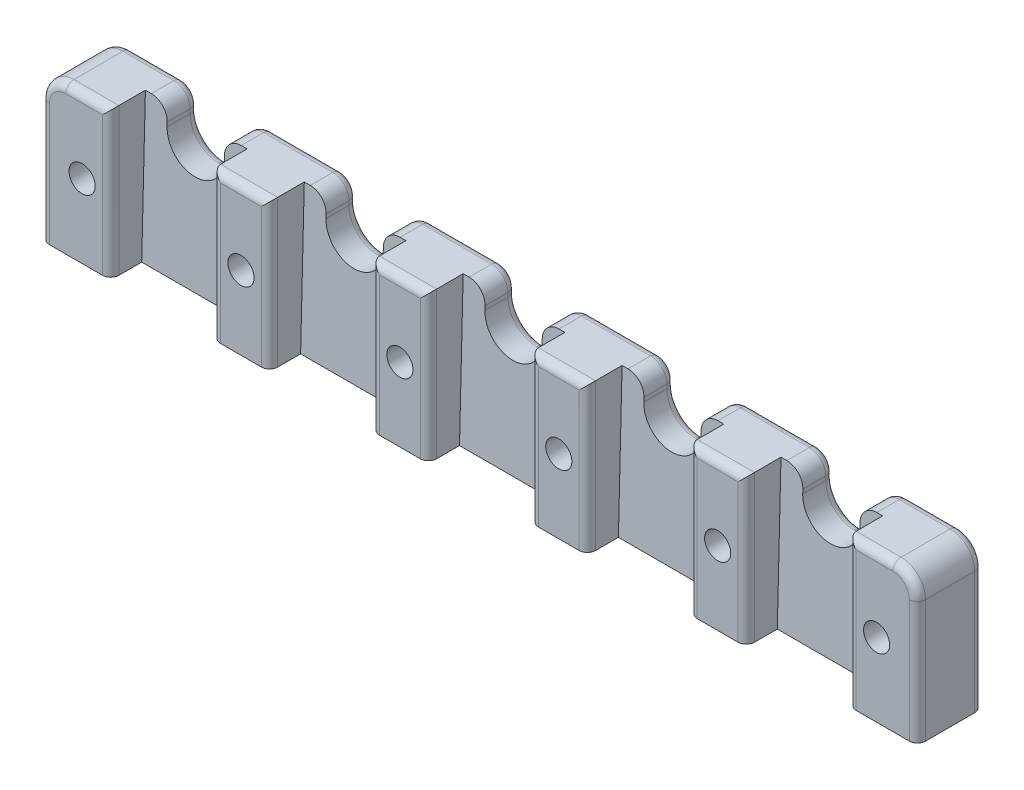
from build123d import *

# Parameters (mm, degrees)
SKETCH1_W                       = 12.45
SKETCH1_H                       = 21.45
BOSS_EXTRUDE1_DEPTH             = 18
SKETCH2_W                       = 10
SKETCH2_H                       = 3
BOSS_EXTRUDE2_DEPTH             = 18
SKETCH4_W                       = 7
SKETCH4_H                       = 8.185466
SKETCH4_H_2                     = 9.121134
SKETCH4_H_3                     = 13.415592
SKETCH4_H_4                     = 10.115072
SKETCH4_H_5                     = 8.5758
CUT_EXTRUDE2_DEPTH              = 6
FILLET3_R                       = 3.5
FILLET4_R                       = 2
SKETCH5_R                       = 1.6
CUT_EXTRUDE3_DEPTH              = 105.163684
CUT_EXTRUDE4_DEPTH              = 105.163684
SKETCH10_W                      = 7.3675
SKETCH10_H                      = 18
SKETCH10_R                      = 1.6
BOSS_EXTRUDE4_DEPTH             = 21.45
FILLET6_R                       = 3
SKETCH11_W                      = 114.139508
SKETCH11_H                      = 1
CUT_EXTRUDE5_DEPTH              = 97.285729
CHAMFER2_SIZE                   = 1
FILLET7_R                       = 1
FILLET8_R                       = 1
FILLET9_R                       = 1
SKETCH13_R                      = 2.05
CUT_EXTRUDE6_DEPTH              = 8
SKETCH14_R                      = 2.05
CUT_EXTRUDE7_DEPTH              = 10
SKETCH15_W                      = 114.000332
SKETCH15_H                      = 33.143594
CUT_EXTRUDE8_DEPTH              = 97.285729
SKETCH16_R                      = 3
CUT_EXTRUDE9_DEPTH              = 2
CHAMFER3_SIZE                   = 0.5
BOSS_EXTRUDE5_REACH             = 91.224
BOSS_EXTRUDE5_DIRECTION_2_DEPTH = 13
SKETCH18_R                      = 1.6
CUT_EXTRUDE10_DEPTH             = 10


with BuildPart() as part:
    # Sketch1 → Boss-Extrude1 (new body)
    with BuildSketch(Plane(origin=(0, 0, 0), x_dir=(1, 0, 0), z_dir=(0, 1, 0))):
        Polygon((-19.225, -19.625), (-5.1, -19.625), (-5.1, -13.725), (5.1, -13.725), (5.1, -19.625), (14.35, -19.625), (14.35, -13.725), (24.55, -13.725), (24.55, -19.625), (33.8, -19.625), (33.8, -13.725), (44, -13.725), (44, -19.625), (53.25, -19.625), (53.25, -13.725), (63.45, -13.725), (63.45, -19.625), (72.7, -19.625), (72.7, -13.725), (82.9, -13.725), (82.9, -19.625), (97.025, -19.625), (97.025, -10.725), (87.025, -10.725), (87.025, 13.725), (-9.225, 13.725), (-9.225, -10.725), (-19.225, -10.725), align=None)
        Rectangle(SKETCH1_W, SKETCH1_H, mode=Mode.SUBTRACT)
        with Locations((19.45, 0)):
            Rectangle(SKETCH1_W, SKETCH1_H, mode=Mode.SUBTRACT)
        with Locations((38.9, 0)):
            Rectangle(SKETCH1_W, SKETCH1_H, mode=Mode.SUBTRACT)
        with Locations((58.35, 0)):
            Rectangle(SKETCH1_W, SKETCH1_H, mode=Mode.SUBTRACT)
        with Locations((77.8, 0)):
            Rectangle(SKETCH1_W, SKETCH1_H, mode=Mode.SUBTRACT)
    extrude(amount=BOSS_EXTRUDE1_DEPTH)

    # Sketch2 → Boss-Extrude2 (add)
    with BuildSketch(Plane(origin=(0, 18, 0), x_dir=(1, 0, 0), z_dir=(0, 1, 0))):
        with Locations((-14.225, -9.225)):
            Rectangle(SKETCH2_W, SKETCH2_H)
        with Locations((92.025, -9.225)):
            Rectangle(SKETCH2_W, SKETCH2_H)
    extrude(amount=-BOSS_EXTRUDE2_DEPTH)

    # Sketch4 → Cut-Extrude2 (cut)
    with BuildSketch(Plane(origin=(0, 18, 0), x_dir=(1, 0, 0), z_dir=(0, 1, 0))):
        with Locations((0, 10.725)):
            Rectangle(SKETCH4_W, SKETCH4_H)
        with Locations((19.45, 10.725)):
            Rectangle(SKETCH4_W, SKETCH4_H_2)
        with Locations((38.9, 10.725)):
            Rectangle(SKETCH4_W, SKETCH4_H_3)
        with Locations((58.35, 10.725)):
            Rectangle(SKETCH4_W, SKETCH4_H_4)
        with Locations((77.8, 10.725)):
            Rectangle(SKETCH4_W, SKETCH4_H_5)
    extrude(amount=-CUT_EXTRUDE2_DEPTH, mode=Mode.SUBTRACT)

    # Fillet3
    fillet3_edges = [part.edges().sort_by_distance(p)[0] for p in [
        (81.3, 12, -12.225),
        (74.3, 12, -12.225),
        (54.85, 12, -12.225),
        (61.85, 12, -12.225),
        (42.4, 12, -12.225),
        (35.4, 12, -12.225),
        (15.95, 12, -12.225),
        (22.95, 12, -12.225),
        (3.5, 12, -12.225),
        (-3.5, 12, -12.225),
    ]]
    fillet(fillet3_edges, radius=FILLET3_R - 0.0001)  # a hair under: the kernel refuses the full size

    # Fillet4
    fillet4_edges = [part.edges().sort_by_distance(p)[0] for p in [
        (74.3, 18, -12.225),
        (81.3, 18, -12.225),
        (54.85, 18, -12.225),
        (61.85, 18, -12.225),
        (35.4, 18, -12.225),
        (42.4, 18, -12.225),
        (15.95, 18, -12.225),
        (22.95, 18, -12.225),
        (-3.5, 18, -12.225),
        (3.5, 18, -12.225),
    ]]
    fillet(fillet4_edges, radius=FILLET4_R)

    # Sketch5 → Cut-Extrude3 (cut, through all)
    with BuildSketch(Plane.XY.offset(19.625)):
        with Locations((9.725, 9)):
            Circle(SKETCH5_R)
        with Locations((29.175, 9)):
            Circle(SKETCH5_R)
        with Locations((48.625, 9)):
            Circle(SKETCH5_R)
        with Locations((68.075, 9)):
            Circle(SKETCH5_R)
        with Locations((87.53, 9)):
            Circle(SKETCH5_R)
        with Locations((-9.73, 9)):
            Circle(SKETCH5_R)
    extrude(amount=-CUT_EXTRUDE3_DEPTH, mode=Mode.SUBTRACT)

    # Sketch7 → Cut-Extrude4 (cut, through all)
    with BuildSketch(Plane(origin=(0, 0, -13.725), x_dir=(-1, 0, 0), z_dir=(0, 0, -1))):
        Polygon((-92.53, 9), (-92.53, -2.934604), (-102.870987, -2.934604), (-102.870987, 21.319522), (-92.53, 21.319522), align=None)
        Polygon((14.73, 9), (14.73, -3.337318), (26.940385, -3.337318), (26.940385, 20.180652), (14.73, 20.180652), align=None)
    extrude(amount=-CUT_EXTRUDE4_DEPTH, mode=Mode.SUBTRACT)

    # Sketch10 → Boss-Extrude4 (add)
    # profile 1 of 2: a face of its own
    with BuildSketch(Plane(origin=(0, 0, 7.725), x_dir=(-1, 0, 0), z_dir=(0, 0, -1))):
        with Locations((-88.84625, 9)):
            Rectangle(SKETCH10_W, SKETCH10_H)
        with Locations(Location((-87.53, 9, 0), (0, 0, 180))):
            Circle(SKETCH10_R, mode=Mode.SUBTRACT)
    # profile 2 of 2: a face of its own
    with BuildSketch(Plane(origin=(0, 0, 7.725), x_dir=(-1, 0, 0), z_dir=(0, 0, -1))):
        with Locations((11.04625, 9)):
            Rectangle(SKETCH10_W, SKETCH10_H)
        with Locations(Location((9.73, 9, 0), (0, 0, 180))):
            Circle(SKETCH10_R, mode=Mode.SUBTRACT)
    extrude(amount=BOSS_EXTRUDE4_DEPTH)

    # Fillet6
    fillet6_edges = [part.edges().sort_by_distance(p)[0] for p in [
        (92.53, 18, 2.95),
        (-14.73, 18, 2.95),
    ]]
    fillet(fillet6_edges, radius=FILLET6_R)

    # Sketch11 → Cut-Extrude5 (cut, through all)
    with BuildSketch(Plane(origin=(0, 18, 0), x_dir=(1, 0, 0), z_dir=(0, 1, 0))):
        with Locations((38.937615, 5.225)):
            Rectangle(SKETCH11_W, SKETCH11_H)
    extrude(amount=-CUT_EXTRUDE5_DEPTH, mode=Mode.SUBTRACT)


with BuildPart() as cut_extrude5_piece_1:
    # of the separate pieces the step leaves, piece 1, a body of its own (cut_extrude5_pieces)
    add(part.part.solids().sort_by_distance((-11.73, 18, -4.725))[0])

    # Chamfer2
    chamfer2_edges = [cut_extrude5_piece_1.edges().sort_by_distance(p)[0] for p in [
        (-9.915, 0, 19.625),
        (-14.73, 0, 7.45),
        (68.075, 0, 19.625),
        (63.45, 0, 16.675),
        (58.35, 0, 13.725),
        (53.25, 0, 16.675),
        (48.625, 0, 19.625),
        (44, 0, 16.675),
        (38.9, 0, 13.725),
        (33.8, 0, 16.675),
        (29.175, 0, 19.625),
        (24.55, 0, 16.675),
        (19.45, 0, 13.725),
        (14.35, 0, 16.675),
        (9.725, 0, 19.625),
        (5.1, 0, 16.675),
        (0, 0, 13.725),
        (-5.1, 0, 16.675),
        (92.53, 0, 7.45),
        (-6.225, 0, 3),
        (6.225, 0, 3),
        (25.675, 0, 3),
        (87.715, 0, 19.625),
        (13.225, 0, 3),
        (45.125, 0, 3),
        (32.675, 0, 3),
        (64.575, 0, 3),
        (52.125, 0, 3),
        (84.025, 0, 3),
        (71.575, 0, 3),
        (82.9, 0, 16.675),
        (77.8, 0, 13.725),
        (72.7, 0, 16.675),
        (77.8, 0, 10.725),
        (9.725, 0, -4.725),
        (88.2775, 0, -4.725),
        (68.075, 0, -4.725),
        (48.625, 0, -4.725),
        (29.175, 0, -4.725),
        (-10.4775, 0, -4.725),
        (58.35, 0, 10.725),
        (38.9, 0, 10.725),
        (19.45, 0, 10.725),
        (0, 0, 10.725),
    ]]
    chamfer(chamfer2_edges, length=CHAMFER2_SIZE)

    # Fillet7
    fillet7_edges = [cut_extrude5_piece_1.edges().sort_by_distance(p)[0] for p in [
        (91.65132, 17.12132, -4.725),
        (71.575, 9.5, -4.725),
        (52.125, 9.5, -4.725),
        (32.675, 9.5, -4.725),
        (13.225, 9.5, -4.725),
        (6.225, 9.5, -4.725),
        (84.025, 9.5, -4.725),
        (64.575, 9.5, -4.725),
        (45.125, 9.5, -4.725),
        (25.675, 9.5, -4.725),
        (-6.225, 9.5, -4.725),
        (-14.73, 8, -4.725),
        (-13.85132, 17.12132, -4.725),
        (9.725, 18, -4.725),
        (86.7775, 18, -4.725),
        (68.075, 18, -4.725),
        (48.625, 18, -4.725),
        (29.175, 18, -4.725),
        (-8.9775, 18, -4.725),
        (92.53, 8, -4.725),
    ]]
    fillet(fillet7_edges, radius=FILLET7_R)

    # Sketch13 → Cut-Extrude6 (cut)
    with BuildSketch(Plane.XY.offset(19.625)):
        with Locations((-9.73, 9)):
            Circle(SKETCH13_R)
        with Locations((9.725, 9)):
            Circle(SKETCH13_R)
        with Locations((29.175, 9)):
            Circle(SKETCH13_R)
        with Locations((48.625, 9)):
            Circle(SKETCH13_R)
        with Locations((68.075, 9)):
            Circle(SKETCH13_R)
        with Locations((87.53, 9)):
            Circle(SKETCH13_R)
    extrude(amount=-CUT_EXTRUDE6_DEPTH, mode=Mode.SUBTRACT)

    # Sketch14 → Cut-Extrude7 (cut)
    with BuildSketch(Plane(origin=(0, 0, -4.725), x_dir=(-1, 0, 0), z_dir=(0, 0, -1))):
        with Locations(Location((-87.53, 9, 0), (0, 0, 180))):
            Circle(SKETCH14_R)
        with Locations(Location((-68.075, 9, 0), (0, 0, 180))):
            Circle(SKETCH14_R)
        with Locations(Location((-48.625, 9, 0), (0, 0, 180))):
            Circle(SKETCH14_R)
        with Locations(Location((-29.175, 9, 0), (0, 0, 180))):
            Circle(SKETCH14_R)
        with Locations(Location((-9.725, 9, 0), (0, 0, 180))):
            Circle(SKETCH14_R)
        with Locations(Location((9.73, 9, 0), (0, 0, 180))):
            Circle(SKETCH14_R)
    extrude(amount=-CUT_EXTRUDE7_DEPTH, mode=Mode.SUBTRACT)

    # Sketch15 → Cut-Extrude8 (cut, through all)
    with BuildSketch(Plane.XZ):
        with Locations((37.916031, 11.427603)):
            Rectangle(SKETCH15_W, SKETCH15_H)
    extrude(amount=-CUT_EXTRUDE8_DEPTH, mode=Mode.SUBTRACT)


with BuildPart() as cut_extrude5_piece_2:
    # of the separate pieces the step leaves, piece 2, a body of its own (cut_extrude5_pieces)
    add(part.part.solids().sort_by_distance((-11.73, 18, -13.725))[0])

    # Fillet8
    fillet8_edges = [cut_extrude5_piece_2.edges().sort_by_distance(p)[0] for p in [
        (6.225, 9, -5.725),
        (84.025, 9, -5.725),
        (91.65132, 17.12132, -5.725),
        (86.7775, 18, -5.725),
        (-6.225, 9, -5.725),
        (-8.9775, 18, -5.725),
        (-13.85132, 17.12132, -5.725),
        (13.225, 9, -5.725),
        (9.725, 18, -5.725),
        (32.675, 9, -5.725),
        (29.175, 18, -5.725),
        (52.125, 9, -5.725),
        (48.625, 18, -5.725),
        (71.575, 9, -5.725),
        (68.075, 18, -5.725),
        (64.575, 9, -5.725),
        (45.125, 9, -5.725),
        (25.675, 9, -5.725),
        (92.53, 7.5, -5.725),
        (-14.73, 7.5, -5.725),
    ]]
    fillet(fillet8_edges, radius=FILLET8_R)

    # Fillet9
    fillet9_edges = [cut_extrude5_piece_2.edges().sort_by_distance(p)[0] for p in [
        (-2.474903, 13.025097, -13.725),
        (2.474903, 13.025097, -13.725),
        (4.085786, 17.414214, -13.725),
        (9.725, 18, -13.725),
        (15.364214, 17.414214, -13.725),
        (16.975097, 13.025097, -13.725),
        (21.924903, 13.025097, -13.725),
        (23.535786, 17.414214, -13.725),
        (29.175, 18, -13.725),
        (34.814214, 17.414214, -13.725),
        (36.425097, 13.025097, -13.725),
        (41.374903, 13.025097, -13.725),
        (42.985786, 17.414214, -13.725),
        (48.625, 18, -13.725),
        (54.264214, 17.414214, -13.725),
        (55.875097, 13.025097, -13.725),
        (60.824903, 13.025097, -13.725),
        (62.435786, 17.414214, -13.725),
        (68.075, 18, -13.725),
        (73.714214, 17.414214, -13.725),
        (75.325097, 13.025097, -13.725),
        (80.274903, 13.025097, -13.725),
        (81.885786, 17.414214, -13.725),
        (86.415, 18, -13.725),
        (91.65132, 17.12132, -13.725),
        (92.53, 7.5, -13.725),
        (81.3, 15.74995, -13.725),
        (74.3, 15.74995, -13.725),
        (61.85, 15.74995, -13.725),
        (54.85, 15.74995, -13.725),
        (42.4, 15.74995, -13.725),
        (35.4, 15.74995, -13.725),
        (22.95, 15.74995, -13.725),
        (15.95, 15.74995, -13.725),
        (3.5, 15.74995, -13.725),
        (-3.5, 15.74995, -13.725),
        (-14.73, 7.5, -13.725),
        (-13.85132, 17.12132, -13.725),
        (-8.615, 18, -13.725),
        (-4.085786, 17.414214, -13.725),
    ]]
    fillet(fillet9_edges, radius=FILLET9_R)

    # Sketch16 → Cut-Extrude9 (cut)
    with BuildSketch(Plane(origin=(0, 0, -13.725), x_dir=(-1, 0, 0), z_dir=(0, 0, -1))):
        with Locations((-87.53, 9)):
            Circle(SKETCH16_R)
        with Locations((-68.075, 9)):
            Circle(SKETCH16_R)
        with Locations((-48.625, 9)):
            Circle(SKETCH16_R)
        with Locations((-29.175, 9)):
            Circle(SKETCH16_R)
        with Locations((-9.725, 9)):
            Circle(SKETCH16_R)
        with Locations((9.73, 9)):
            Circle(SKETCH16_R)
    extrude(amount=-CUT_EXTRUDE9_DEPTH, mode=Mode.SUBTRACT)

    # Chamfer3
    chamfer3_edges = [cut_extrude5_piece_2.edges().sort_by_distance(p)[0] for p in [
        (90.53, 9, -13.725),
        (71.075, 9, -13.725),
        (51.625, 9, -13.725),
        (32.175, 9, -13.725),
        (12.725, 9, -13.725),
        (-6.73, 9, -13.725),
    ]]
    chamfer(chamfer3_edges, length=CHAMFER3_SIZE)

    # Boss-Extrude5: up to this face of the body (flat: up to its plane)
    boss_extrude5_end = Plane(cut_extrude5_piece_2.part.faces().sort_by_distance((84.025, 9, -8.725))[0])
    # Sketch17 → Boss-Extrude5 (add, up to the picked face)
    with BuildSketch(Plane.ZY.offset(-6.225), mode=Mode.PRIVATE) as boss_extrude5_sk1:
        Polygon((-10.725, 18), (-10.725, 0), (-9.525, 0), (-9.975, 18), align=None)
    boss_extrude5_tool1 = split(extrude(boss_extrude5_sk1.sketch, amount=-BOSS_EXTRUDE5_REACH, mode=Mode.PRIVATE), bisect_by=boss_extrude5_end, keep=Keep.BOTH, mode=Mode.PRIVATE)
    add(boss_extrude5_tool1.solids().sort_by(Axis((6.225, 8.307692, -10.228846), (1, 0, 0)))[0])

    # Sketch17 → Boss-Extrude5 direction 2 (add)
    with BuildSketch(Plane.ZY.offset(-6.225)):
        Polygon((-10.725, 18), (-10.725, 0), (-9.525, 0), (-9.975, 18), align=None)
    extrude(amount=BOSS_EXTRUDE5_DIRECTION_2_DEPTH)

    # Sketch18 → Cut-Extrude10 (cut)
    with BuildSketch(Plane(origin=(0, 0, -13.725), x_dir=(-1, 0, 0), z_dir=(0, 0, -1))):
        with Locations((-68.075, 9)):
            Circle(SKETCH18_R)
        with Locations((-48.625, 9)):
            Circle(SKETCH18_R)
        with Locations((-29.175, 9)):
            Circle(SKETCH18_R)
        with Locations((-9.725, 9)):
            Circle(SKETCH18_R)
        with BuildLine():
            Line((-72.3, 18), (-83.3, 18))
            ThreePointArc((-83.3, 18), (-81.885786, 17.414214), (-81.3, 16))
            Line((-81.3, 16), (-81.3, 15.5))
            ThreePointArc((-81.3, 15.5), (-80.274874, 13.025126), (-77.8, 12))
            ThreePointArc((-77.8, 12), (-75.325126, 13.025126), (-74.3, 15.5))
            Line((-74.3, 15.5), (-74.3, 16))
            ThreePointArc((-74.3, 16), (-73.714214, 17.414214), (-72.3, 18))
        make_face()
        with BuildLine():
            Line((-52.85, 18), (-63.85, 18))
            ThreePointArc((-63.85, 18), (-62.435786, 17.414214), (-61.85, 16))
            Line((-61.85, 16), (-61.85, 15.5))
            ThreePointArc((-61.85, 15.5), (-60.824874, 13.025126), (-58.35, 12))
            ThreePointArc((-58.35, 12), (-55.875126, 13.025126), (-54.85, 15.5))
            Line((-54.85, 15.5), (-54.85, 16))
            ThreePointArc((-54.85, 16), (-54.264214, 17.414214), (-52.85, 18))
        make_face()
        with BuildLine():
            Line((-33.4, 18), (-44.4, 18))
            ThreePointArc((-44.4, 18), (-42.985786, 17.414214), (-42.4, 16))
            Line((-42.4, 16), (-42.4, 15.5))
            ThreePointArc((-42.4, 15.5), (-41.374874, 13.025126), (-38.9, 12))
            ThreePointArc((-38.9, 12), (-36.425126, 13.025126), (-35.4, 15.5))
            Line((-35.4, 15.5), (-35.4, 16))
            ThreePointArc((-35.4, 16), (-34.814214, 17.414214), (-33.4, 18))
        make_face()
        with BuildLine():
            Line((-22.95, 16), (-22.95, 15.5))
            ThreePointArc((-22.95, 15.5), (-21.924874, 13.025126), (-19.45, 12))
            ThreePointArc((-19.45, 12), (-16.975126, 13.025126), (-15.95, 15.5))
            Line((-15.95, 15.5), (-15.95, 16))
            ThreePointArc((-15.95, 16), (-15.364214, 17.414214), (-13.95, 18))
            Line((-13.95, 18), (-24.95, 18))
            ThreePointArc((-24.95, 18), (-23.535786, 17.414214), (-22.95, 16))
        make_face()
        with BuildLine():
            Line((-3.5, 16), (-3.5, 15.5))
            ThreePointArc((-3.5, 15.5), (-2.474874, 13.025126), (0, 12))
            ThreePointArc((0, 12), (2.474874, 13.025126), (3.5, 15.5))
            Line((3.5, 15.5), (3.5, 16))
            ThreePointArc((3.5, 16), (4.085786, 17.414214), (5.5, 18))
            Line((5.5, 18), (-5.5, 18))
            ThreePointArc((-5.5, 18), (-4.085786, 17.414214), (-3.5, 16))
        make_face()
    extrude(amount=-CUT_EXTRUDE10_DEPTH, mode=Mode.SUBTRACT)


solid = cut_extrude5_piece_2.part
